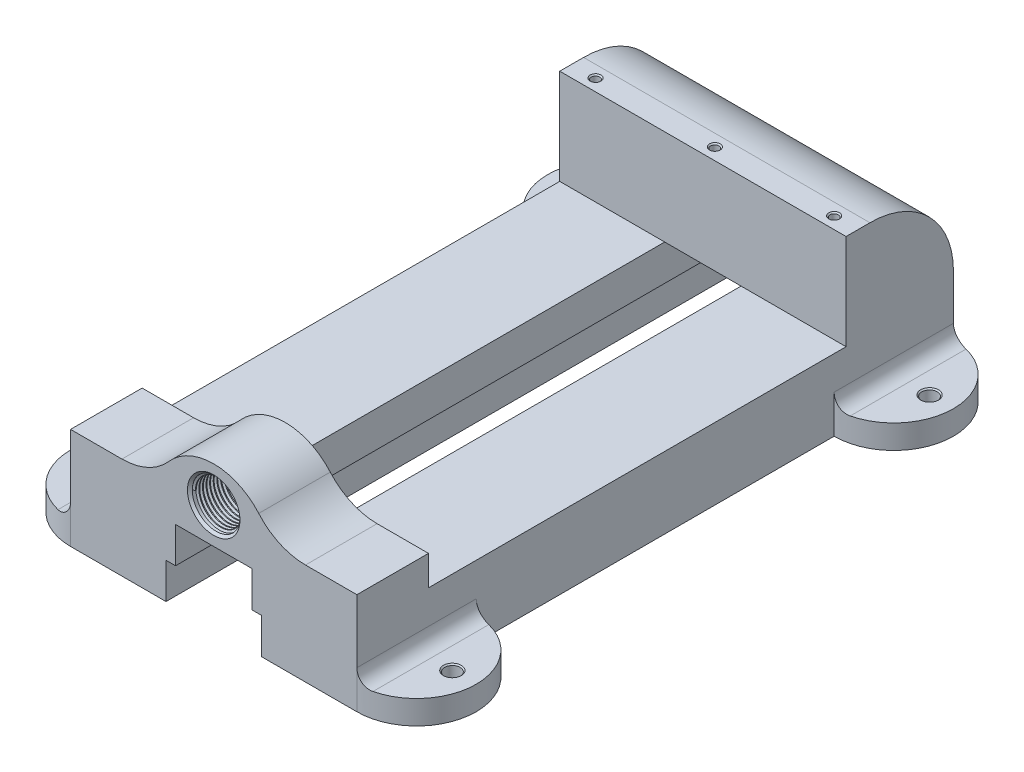
from build123d import *

# Parameters (mm, degrees)
SKETCH1_W                      = 120
SKETCH1_H                      = 250
BOSS_EXTRUDE1_DEPTH            = 70
BOSS_EXTRUDE2_DEPTH            = 10
CUT_EXTRUDE2_DEPTH             = 167.58331249
CUT_EXTRUDE2_DEPTH_BACK        = 167.58331249
CUT_EXTRUDE3_DEPTH             = 167.58331249
CUT_EXTRUDE3_DEPTH_BACK        = 167.58331249
BOSS_EXTRUDE3_DEPTH            = 30
FILLET1_R                      = 6
FILLET2_R                      = 26
CUT_EXTRUDE4_DEPTH             = 163.634559802
CUT_EXTRUDE4_DEPTH_BACK        = 163.634559802
SKETCH6_R                      = 3.25
CUT_EXTRUDE5_REACH             = 275.176
SKETCH7_R                      = 10
CUT_EXTRUDE5_DIRECTION_2_DEPTH = 274.175767716
SKETCH8_R                      = 1.75
CUT_EXTRUDE6_DEPTH             = 5
CHAMFER1_SIZE                  = 1
CHAMFER2_SIZE                  = 0.5
THREAD1_PITCH                  = 1.5


with BuildPart() as part:
    # Sketch1 → Boss-Extrude1 (new body)
    with BuildSketch(Plane(origin=(0, 0, 0), x_dir=(1, 0, 0), z_dir=(0, 1, 0))):
        Rectangle(SKETCH1_W, SKETCH1_H)
    extrude(amount=BOSS_EXTRUDE1_DEPTH)

    # Sketch2 → Boss-Extrude2 (add)
    with BuildSketch(Plane(origin=(0, 0, 0), x_dir=(1, 0, 0), z_dir=(0, 1, 0))):
        with BuildLine():
            Line((60, 125), (60, 75))
            ThreePointArc((60, 75), (85, 100), (60, 125))
        make_face()
        with BuildLine():
            Line((60, -125), (60, -75))
            ThreePointArc((60, -75), (85, -100), (60, -125))
        make_face()
        with BuildLine():
            Line((-60, -125), (-60, -75))
            ThreePointArc((-60, -75), (-85, -100), (-60, -125))
        make_face()
        with BuildLine():
            Line((-60, 125), (-60, 75))
            ThreePointArc((-60, 75), (-85, 100), (-60, 125))
        make_face()
    extrude(amount=BOSS_EXTRUDE2_DEPTH)

    # Sketch3 → Cut-Extrude2 (cut, two sides: drawn at the far end of the back side and taken through both)
    with BuildSketch(Plane(origin=(0, 0, 0), x_dir=(0, 0, -1), z_dir=(1, 0, 0)).offset(-CUT_EXTRUDE2_DEPTH_BACK)):
        with BuildLine():
            Line((125, 70), (90, 70))
            ThreePointArc((90, 70), (114.748737342, 59.748737342), (125, 35))
            Line((125, 35), (125, 70))
        make_face()
        Polygon((-125, 70), (-125, 42.5), (-95, 42.5), (-95, 30), (80, 30), (80, 70), align=None)
    extrude(amount=CUT_EXTRUDE2_DEPTH + CUT_EXTRUDE2_DEPTH_BACK, mode=Mode.SUBTRACT)

    # Sketch4 → Cut-Extrude3 (cut, two sides: drawn at the far end of the back side and taken through both)
    with BuildSketch(Plane.XY.offset(-CUT_EXTRUDE3_DEPTH_BACK)):
        Polygon((-20, 0), (-20, 15), (-16, 15), (-16, 30), (16, 30), (16, 15), (20, 15), (20, 0), align=None)
    extrude(amount=CUT_EXTRUDE3_DEPTH + CUT_EXTRUDE3_DEPTH_BACK, mode=Mode.SUBTRACT)

    # Sketch5 → Boss-Extrude3 (add)
    with BuildSketch(Plane(origin=(0, 0, 95), x_dir=(-1, 0, 0), z_dir=(0, 0, -1))):
        with BuildLine():
            Line((23.848480035, 42.5), (-23.848480035, 42.5))
            ThreePointArc((-23.848480035, 42.5), (0, 60), (23.848480035, 42.5))
        make_face()
    extrude(amount=-BOSS_EXTRUDE3_DEPTH)

    # Fillet1
    # the kernel refuses this fillet: 6 mm, written as the material it adds along each edge
    with BuildSketch(Plane(origin=(-60, 10, -140), x_dir=(0, 1, 0), z_dir=(0, 0, 1))) as fillet1_piece_1_section:
        with BuildLine():
            CenterArc((FILLET1_R, FILLET1_R), FILLET1_R, 180, 90)
            Line((0, FILLET1_R), (0, 0))
            Line((0, 0), (FILLET1_R, 0))
        make_face()
    fillet1_piece_1 = extrude(amount=80, mode=Mode.PRIVATE)
    fillet1_piece_1 = fillet1_piece_1 & Plane(origin=(-60, 10, -100), x_dir=(0, 0, 1), z_dir=(0, -1, 0)) * Cylinder(25, 184, mode=Mode.PRIVATE)
    add(fillet1_piece_1)
    with BuildSketch(Plane(origin=(-60, 10, 140), x_dir=(0, 1, 0), z_dir=(0, 0, -1))) as fillet1_piece_2_section:
        with BuildLine():
            CenterArc((FILLET1_R, -FILLET1_R), FILLET1_R, 90, 90)
            Line((0, -FILLET1_R), (0, 0))
            Line((0, 0), (FILLET1_R, 0))
        make_face()
    fillet1_piece_2 = extrude(amount=80, mode=Mode.PRIVATE)
    fillet1_piece_2 = fillet1_piece_2 & Plane(origin=(-60, 10, 100), x_dir=(0, 0, -1), z_dir=(0, -1, 0)) * Cylinder(25, 184, mode=Mode.PRIVATE)
    add(fillet1_piece_2)
    with BuildSketch(Plane(origin=(60, 10, 140), x_dir=(0, 1, 0), z_dir=(0, 0, -1))) as fillet1_piece_3_section:
        with BuildLine():
            CenterArc((FILLET1_R, FILLET1_R), FILLET1_R, 180, 90)
            Line((0, FILLET1_R), (0, 0))
            Line((0, 0), (FILLET1_R, 0))
        make_face()
    fillet1_piece_3 = extrude(amount=80, mode=Mode.PRIVATE)
    fillet1_piece_3 = fillet1_piece_3 & Plane(origin=(60, 10, 100), x_dir=(0, 0, -1), z_dir=(0, -1, 0)) * Cylinder(25, 184, mode=Mode.PRIVATE)
    add(fillet1_piece_3)
    with BuildSketch(Plane(origin=(60, 10, -140), x_dir=(0, 1, 0), z_dir=(0, 0, 1))) as fillet1_piece_4_section:
        with BuildLine():
            CenterArc((FILLET1_R, -FILLET1_R), FILLET1_R, 90, 90)
            Line((0, -FILLET1_R), (0, 0))
            Line((0, 0), (FILLET1_R, 0))
        make_face()
    fillet1_piece_4 = extrude(amount=80, mode=Mode.PRIVATE)
    fillet1_piece_4 = fillet1_piece_4 & Plane(origin=(60, 10, -100), x_dir=(0, 0, 1), z_dir=(0, -1, 0)) * Cylinder(25, 184, mode=Mode.PRIVATE)
    add(fillet1_piece_4)

    # Fillet2
    fillet2_edges = [part.edges().sort_by_distance(p)[0] for p in [
        (23.848480035, 42.5, 110),
        (-23.848480035, 42.5, 110),
    ]]
    fillet(fillet2_edges, radius=FILLET2_R)

    # Sketch6 → Cut-Extrude4 (cut, two sides: drawn at the far end of the back side and taken through both)
    with BuildSketch(Plane(origin=(0, 10, 0), x_dir=(1, 0, 0), z_dir=(0, 1, 0)).offset(-CUT_EXTRUDE4_DEPTH_BACK)):
        with Locations(Location((-75, 100, 0), (0, 0, 270))):
            Circle(SKETCH6_R)
        with Locations(Location((75, 100, 0), (0, 0, 90))):
            Circle(SKETCH6_R)
        with Locations(Location((-75, -100, 0), (0, 0, 90))):
            Circle(SKETCH6_R)
        with Locations(Location((75, -100, 0), (0, 0, 270))):
            Circle(SKETCH6_R)
    extrude(amount=CUT_EXTRUDE4_DEPTH + CUT_EXTRUDE4_DEPTH_BACK, mode=Mode.SUBTRACT)

    # Sketch7 → Cut-Extrude5 (cut, up to next)
    with BuildSketch(Plane.XY.offset(125), mode=Mode.PRIVATE) as cut_extrude5_sk1:
        with Locations(Location((0, 45, 0), (0, 0, 180))):
            Circle(SKETCH7_R)
    cut_extrude5_tool1 = extrude(cut_extrude5_sk1.sketch, amount=-CUT_EXTRUDE5_REACH, mode=Mode.PRIVATE) & part.part
    add(cut_extrude5_tool1.solids().sort_by_distance((0, 45, 125))[0], mode=Mode.SUBTRACT)

    # Sketch7 → Cut-Extrude5 direction 2 (cut)
    with BuildSketch(Plane.XY.offset(125)):
        with Locations(Location((0, 45, 0), (0, 0, 180))):
            Circle(SKETCH7_R)
    extrude(amount=CUT_EXTRUDE5_DIRECTION_2_DEPTH, mode=Mode.SUBTRACT)

    # Sketch8 → Cut-Extrude6 (cut)
    with BuildSketch(Plane(origin=(0, 70, 0), x_dir=(1, 0, 0), z_dir=(0, 1, 0))):
        with Locations(Location((-50, 85, 0), (0, 0, 270))):
            Circle(SKETCH8_R)
        with Locations(Location((0, 85, 0), (0, 0, 270))):
            Circle(SKETCH8_R)
        with Locations(Location((50, 85, 0), (0, 0, 270))):
            Circle(SKETCH8_R)
    extrude(amount=-CUT_EXTRUDE6_DEPTH, mode=Mode.SUBTRACT)

    # Chamfer1
    chamfer1_edges = [part.edges().sort_by_distance(p)[0] for p in [
        (10, 45, 125),
    ]]
    chamfer(chamfer1_edges, length=CHAMFER1_SIZE)

    # Chamfer2
    chamfer2_edges = [part.edges().sort_by_distance(p)[0] for p in [
        (75, 10, -96.75),
        (-75, 10, 103.25),
        (75, 10, 96.75),
        (-75, 10, -103.25),
        (50, 70, -86.75),
        (-50, 70, -86.75),
        (0, 70, -86.75),
    ]]
    chamfer(chamfer2_edges, length=CHAMFER2_SIZE)

    # Thread1: arcs per turn and ends read off the stored shape
    # Thread1: the profile of Thread Profile2 profile screwed along a right-hand helix through 18.333333 turns, 8 arcs to a turn; built about Z, then put on its axis
    thread1_z = Axis((0, 0, 0), (0, 0, 1))
    thread1_corners = [(10.0003, 0, -0.000173205), (10.0003, 0, 1.312673201), (9.188101188, 0, 0.843749998), (9.188101188, 0, 0.468749998)]
    with BuildLine(mode=Mode.PRIVATE) as thread1_profile:
        Line(thread1_corners[0], thread1_corners[1])
        Line(thread1_corners[1], thread1_corners[2])
        Line(thread1_corners[2], thread1_corners[3])
        Line(thread1_corners[3], thread1_corners[0])
    thread1_cap = Face(thread1_profile.wire())
    thread1_turn_angles = [0, 22.5, 45, 67.5, 90, 112.5, 135, 157.5, 180, 202.5, 225, 247.5, 270, 292.5, 315, 337.5, 360]
    thread1_turn_weights = [1, 0.9238795325112867, 1, 0.9238795325112867, 1, 0.9238795325112867, 1, 0.9238795325112867, 1, 0.9238795325112867, 1, 0.9238795325112867, 1, 0.9238795325112867, 1, 0.9238795325112867, 1]
    thread1_turn_rails = [Edge.make_bspline([Vector(p[0], p[1], 0).rotate(thread1_z, thread1_turn_angles[k]) / thread1_turn_weights[k] + Vector(0, 0, p[2] + THREAD1_PITCH * thread1_turn_angles[k] / 360) for k in range(17)], [0, 0, 0, 1, 1, 2, 2, 3, 3, 4, 4, 5, 5, 6, 6, 7, 7, 8, 8, 8], 2, thread1_turn_weights) for p in thread1_corners]
    thread1_turn_sides = [Face.make_surface_from_curves(thread1_turn_rails[p[0]], thread1_turn_rails[p[1]]) for p in [(0, 1), (1, 2), (2, 3), (3, 0)]]
    thread1_last_angles = [6480, 6502.5, 6525, 6547.5, 6570, 6585, 6600]
    thread1_last_weights = [1, 0.9238795325112867, 1, 0.9238795325112867, 1, 0.9659258262890683, 1]
    thread1_last_rails = [Edge.make_bspline([Vector(p[0], p[1], 0).rotate(thread1_z, thread1_last_angles[k]) / thread1_last_weights[k] + Vector(0, 0, p[2] + THREAD1_PITCH * thread1_last_angles[k] / 360) for k in range(7)], [0, 0, 0, 1, 1, 2, 2, 3, 3, 3], 2, thread1_last_weights) for p in thread1_corners]
    thread1_last_sides = [Face.make_surface_from_curves(thread1_last_rails[p[0]], thread1_last_rails[p[1]]) for p in [(0, 1), (1, 2), (2, 3), (3, 0)]]
    thread1 = Plane(origin=(0, 45, 124), x_dir=(-1, 0, 0), z_dir=(0, 0, -1)) * Solid(Shell([*[p.moved(Location((0, 0, THREAD1_PITCH * i))) for i in range(18) for p in thread1_turn_sides], *thread1_last_sides, thread1_cap, thread1_cap.rotate(thread1_z, 6600).moved(Location((0, 0, THREAD1_PITCH * 6600 / 360)))]))
    add(thread1)


solid = part.part
